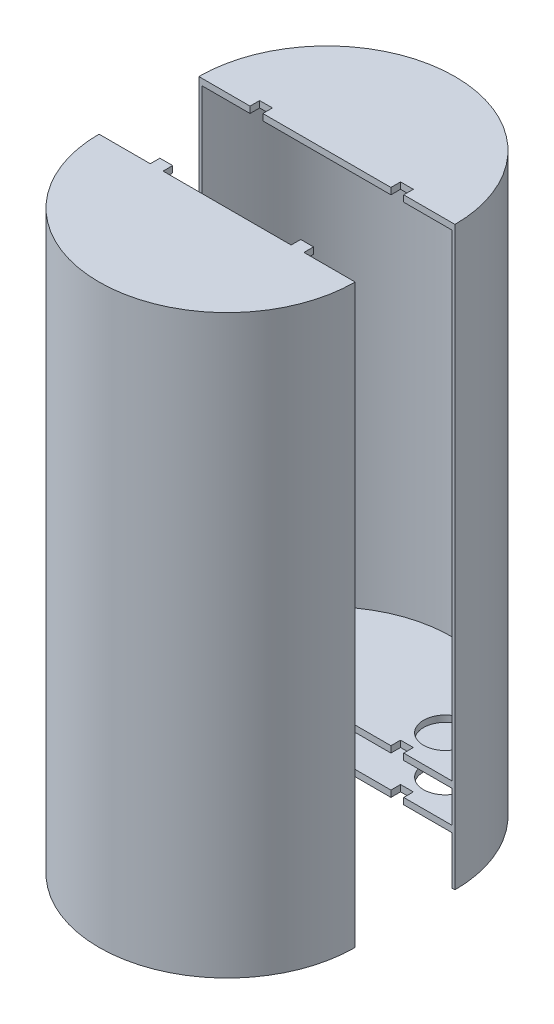
from build123d import *

# Parameters (mm, degrees)
SKETCH1_R               = 40
BOSS_EXTRUDE1_DEPTH     = 180
SKETCH3_R               = 39
CUT_EXTRUDE1_DEPTH      = 163
CUT_EXTRUDE2_START      = -15
SKETCH5_R               = 39
CUT_EXTRUDE2_DEPTH      = 15
SKETCH6_R               = 40
BOSS_EXTRUDE2_DEPTH     = 2
BOSS_EXTRUDE3_START     = -2
SKETCH7_R               = 40
BOSS_EXTRUDE3_DEPTH     = 2
SPLIT1_SURFACE_1_BACK   = 213.603
SPLIT1_SURFACE_1_DEPTH  = 427.206
SPLIT1_SURFACE_2_BACK   = 213.603
SPLIT1_SURFACE_2_DEPTH  = 427.206
BODY_MOVE_COPY1_DEPTH   = 180
BODY_MOVE_COPY1_START   = 29
BODY_MOVE_COPY1_2_DEPTH = 149
BODY_MOVE_COPY1_3_DEPTH = 15
BODY_MOVE_COPY1_START_2 = 17
BODY_MOVE_COPY1_4_DEPTH = 10
BODY_MOVE_COPY1_5_DEPTH = 180
BODY_MOVE_COPY1_START_3 = 15
BODY_MOVE_COPY1_6_DEPTH = 2
BODY_MOVE_COPY1_START_4 = 27
BODY_MOVE_COPY1_7_DEPTH = 2
BODY_MOVE_COPY1_START_5 = 178
BODY_MOVE_COPY1_8_DEPTH = 2
SKETCH9_R               = 15.2
CUT_EXTRUDE3_DEPTH      = 2
CUT_EXTRUDE4_DEPTH      = 2
SKETCH11_R              = 3.12
CUT_EXTRUDE5_DEPTH      = 172.657213337
SKETCH14_R              = 6.8
CUT_EXTRUDE6_DEPTH      = 172.657213337


# Read off the part's stored shape, not the designer's step: Body-Move/Copy1
with BuildPart() as part:
    # Sketch1 → Boss-Extrude1 (new body)
    with BuildSketch(Plane(origin=(0, 0, 0), x_dir=(1, 0, 0), z_dir=(0, 1, 0))):
        with Locations(Location((0, 0, 0), (0, 0, 90))):
            Circle(SKETCH1_R)
    extrude(amount=BOSS_EXTRUDE1_DEPTH)

    # Sketch3 → Cut-Extrude1 (cut)
    with BuildSketch(Plane(origin=(0, 180, 0), x_dir=(1, 0, 0), z_dir=(0, 1, 0))):
        with Locations(Location((0, 0, 0), (0, 0, 270))):
            Circle(SKETCH3_R)
    extrude(amount=-CUT_EXTRUDE1_DEPTH, mode=Mode.SUBTRACT)

    # Sketch5 → Cut-Extrude2 (cut)
    with BuildSketch(Plane.XZ.offset(CUT_EXTRUDE2_START)):
        with Locations(Location((0, 0, 0), (0, 0, 90))):
            Circle(SKETCH5_R)
    extrude(amount=CUT_EXTRUDE2_DEPTH, mode=Mode.SUBTRACT)

    # Sketch6 → Boss-Extrude2 (add)
    with BuildSketch(Plane(origin=(0, 27, 0), x_dir=(1, 0, 0), z_dir=(0, 1, 0))):
        with Locations(Location((0, 0, 0), (0, 0, 90))):
            Circle(SKETCH6_R)
    extrude(amount=BOSS_EXTRUDE2_DEPTH)

    # Sketch7 → Boss-Extrude3 (add)
    with BuildSketch(Plane(origin=(0, 180, 0), x_dir=(1, 0, 0), z_dir=(0, 1, 0)).offset(BOSS_EXTRUDE3_START)):
        with Locations(Location((0, 0, 0), (0, 0, 90))):
            Circle(SKETCH7_R)
    extrude(amount=BOSS_EXTRUDE3_DEPTH)


with BuildPart() as body_2:
    # Split1: the piece behind the surface
    add(part.part)
    # Split1 surface: a surface, the sketch's curves swept straight by 427.206 mm
    with BuildLine(Plane(origin=(0, 180, 0), x_dir=(1, 0, 0), z_dir=(0, 1, 0)).offset(-SPLIT1_SURFACE_1_BACK), mode=Mode.PRIVATE) as split1_surface_1_path:
        Line((-40, 0), (-24, 0))
        Line((-24, 0), (-24, 3))
        Line((-24, 3), (-20, 3))
        Line((-20, 3), (-20, 0))
        Line((-20, 0), (20, 0))
        Line((20, 0), (20, 3))
        Line((20, 3), (24, 3))
        Line((24, 3), (24, 0))
        Line((24, 0), (40, 0))
    split1_surface_1 = Shell.extrude(split1_surface_1_path.wire(), (0 * SPLIT1_SURFACE_1_DEPTH, 1 * SPLIT1_SURFACE_1_DEPTH, 0 * SPLIT1_SURFACE_1_DEPTH))
    split(bisect_by=split1_surface_1, keep=Keep.BOTTOM)

    # Body-Move/Copy1 outline → Body-Move/Copy1 (cut)
    with BuildSketch(Plane(origin=(0, 0, 0), x_dir=(1, 0, 0), z_dir=(0, 1, 0))):
        with BuildLine():
            Line((20, -28.170210697), (24, -28.170210697))
            Line((24, -28.170210697), (24, -31.170210697))
            Line((24, -31.170210697), (25.068266097, -31.170210697))
            ThreePointArc((25.068266097, -31.170210697), (36.074441395, -17.281049681), (40, 0))
            Line((40, 0), (24, 0))
            Line((24, 0), (24, 3))
            Line((24, 3), (20, 3))
            Line((20, 3), (20, 0))
            Line((20, 0), (-20, 0))
            Line((-20, 0), (-20, 3))
            Line((-20, 3), (-24, 3))
            Line((-24, 3), (-24, 0))
            Line((-24, 0), (-40, 0))
            ThreePointArc((-40, 0), (-36.074441395, -17.281049681), (-25.068266097, -31.170210697))
            Line((-25.068266097, -31.170210697), (-24, -31.170210697))
            Line((-24, -31.170210697), (-24, -28.170210697))
            Line((-24, -28.170210697), (-20, -28.170210697))
            Line((-20, -28.170210697), (-20, -31.170210697))
            Line((-20, -31.170210697), (20, -31.170210697))
            Line((20, -31.170210697), (20, -28.170210697))
        make_face()
    extrude(amount=BODY_MOVE_COPY1_DEPTH, mode=Mode.SUBTRACT)

    # Body-Move_Copy1 2 outline → Body-Move_Copy1 2 (cut)
    with BuildSketch(Plane(origin=(0, 0, 0), x_dir=(1, 0, 0), z_dir=(0, 1, 0)).offset(BODY_MOVE_COPY1_START)):
        with BuildLine():
            Line((24, -31.170210697), (24, -30.740852298))
            ThreePointArc((24, -30.740852298), (0, -39), (-24, -30.740852298))
            Line((-24, -30.740852298), (-24, -31.170210697))
            Line((-24, -31.170210697), (-25.068266097, -31.170210697))
            ThreePointArc((-25.068266097, -31.170210697), (0, -40), (25.068266097, -31.170210697))
            Line((25.068266097, -31.170210697), (24, -31.170210697))
        make_face()
    extrude(amount=BODY_MOVE_COPY1_2_DEPTH, mode=Mode.SUBTRACT)

    # Body-Move_Copy1 3 outline → Body-Move_Copy1 3 (cut)
    with BuildSketch(Plane(origin=(0, 0, 0), x_dir=(1, 0, 0), z_dir=(0, 1, 0))):
        with BuildLine():
            Line((24, -31.170210697), (24, -30.740852298))
            ThreePointArc((24, -30.740852298), (0, -39), (-24, -30.740852298))
            Line((-24, -30.740852298), (-24, -31.170210697))
            Line((-24, -31.170210697), (-25.068266097, -31.170210697))
            ThreePointArc((-25.068266097, -31.170210697), (0, -40), (25.068266097, -31.170210697))
            Line((25.068266097, -31.170210697), (24, -31.170210697))
        make_face()
    extrude(amount=BODY_MOVE_COPY1_3_DEPTH, mode=Mode.SUBTRACT)

    # Body-Move_Copy1 4 outline → Body-Move_Copy1 4 (cut)
    with BuildSketch(Plane(origin=(0, 0, 0), x_dir=(1, 0, 0), z_dir=(0, 1, 0)).offset(BODY_MOVE_COPY1_START_2)):
        with BuildLine():
            Line((24, -31.170210697), (24, -30.740852298))
            ThreePointArc((24, -30.740852298), (0, -39), (-24, -30.740852298))
            Line((-24, -30.740852298), (-24, -31.170210697))
            Line((-24, -31.170210697), (-25.068266097, -31.170210697))
            ThreePointArc((-25.068266097, -31.170210697), (0, -40), (25.068266097, -31.170210697))
            Line((25.068266097, -31.170210697), (24, -31.170210697))
        make_face()
    extrude(amount=BODY_MOVE_COPY1_4_DEPTH, mode=Mode.SUBTRACT)



with BuildPart() as part_1:
    add(part.part)

    # Split1: split by a surface, the side it looks to stays
    # Split1 surface: a surface, the sketch's curves swept straight by 427.206 mm
    with BuildLine(Plane(origin=(0, 180, 0), x_dir=(1, 0, 0), z_dir=(0, 1, 0)).offset(-SPLIT1_SURFACE_2_BACK), mode=Mode.PRIVATE) as split1_surface_2_path:
        Line((-40, 0), (-24, 0))
        Line((-24, 0), (-24, 3))
        Line((-24, 3), (-20, 3))
        Line((-20, 3), (-20, 0))
        Line((-20, 0), (20, 0))
        Line((20, 0), (20, 3))
        Line((20, 3), (24, 3))
        Line((24, 3), (24, 0))
        Line((24, 0), (40, 0))
    split1_surface_2 = Shell.extrude(split1_surface_2_path.wire(), (0 * SPLIT1_SURFACE_2_DEPTH, 1 * SPLIT1_SURFACE_2_DEPTH, 0 * SPLIT1_SURFACE_2_DEPTH))
    split(bisect_by=split1_surface_2, keep=Keep.TOP)

    # Sketch14 → Cut-Extrude6 (cut, through all)
    with BuildSketch(Plane(origin=(0, 29, 0), x_dir=(1, 0, 0), z_dir=(0, 1, 0))):
        with Locations(Location((25, 12, 0), (0, 0, 270))):
            Circle(SKETCH14_R)
    extrude(amount=-CUT_EXTRUDE6_DEPTH, mode=Mode.SUBTRACT)


with BuildPart() as body_3:
    # Body-Move_Copy1 5 outline → Body-Move_Copy1 5 (new body)
    with BuildSketch(Plane(origin=(0, 0, 0), x_dir=(1, 0, 0), z_dir=(0, 1, 0))):
        with BuildLine():
            Line((40, -31.170210697), (39, -31.170210697))
            ThreePointArc((39, -31.170210697), (0, -70.170210697), (-39, -31.170210697))
            Line((-39, -31.170210697), (-40, -31.170210697))
            ThreePointArc((-40, -31.170210697), (0, -71.170210697), (40, -31.170210697))
        make_face()
    extrude(amount=BODY_MOVE_COPY1_5_DEPTH)


with BuildPart() as body_2_1:
    add(body_2.part)

    add(body_3.part)  # Body-Move_Copy1 6 merges body 3
    # Body-Move_Copy1 6 outline → Body-Move_Copy1 6 (add)
    with BuildSketch(Plane(origin=(0, 0, 0), x_dir=(1, 0, 0), z_dir=(0, 1, 0)).offset(BODY_MOVE_COPY1_START_3)):
        with BuildLine():
            Line((39, -31.170210697), (25.068266097, -31.170210697))
            ThreePointArc((25.068266097, -31.170210697), (0, -40), (-25.068266097, -31.170210697))
            Line((-25.068266097, -31.170210697), (-39, -31.170210697))
            ThreePointArc((-39, -31.170210697), (0, -70.170210697), (39, -31.170210697))
        make_face()
    extrude(amount=BODY_MOVE_COPY1_6_DEPTH)

    # Body-Move_Copy1 7 outline → Body-Move_Copy1 7 (add)
    with BuildSketch(Plane(origin=(0, 0, 0), x_dir=(1, 0, 0), z_dir=(0, 1, 0)).offset(BODY_MOVE_COPY1_START_4)):
        with BuildLine():
            Line((39, -31.170210697), (25.068266097, -31.170210697))
            ThreePointArc((25.068266097, -31.170210697), (0, -40), (-25.068266097, -31.170210697))
            Line((-25.068266097, -31.170210697), (-39, -31.170210697))
            ThreePointArc((-39, -31.170210697), (0, -70.170210697), (39, -31.170210697))
        make_face()
    extrude(amount=BODY_MOVE_COPY1_7_DEPTH)

    # Body-Move_Copy1 8 outline → Body-Move_Copy1 8 (add)
    with BuildSketch(Plane(origin=(0, 0, 0), x_dir=(1, 0, 0), z_dir=(0, 1, 0)).offset(BODY_MOVE_COPY1_START_5)):
        with BuildLine():
            Line((39, -31.170210697), (25.068266097, -31.170210697))
            ThreePointArc((25.068266097, -31.170210697), (0, -40), (-25.068266097, -31.170210697))
            Line((-25.068266097, -31.170210697), (-39, -31.170210697))
            ThreePointArc((-39, -31.170210697), (0, -70.170210697), (39, -31.170210697))
        make_face()
    extrude(amount=BODY_MOVE_COPY1_8_DEPTH)

    # Sketch9 → Cut-Extrude3 (cut)
    with BuildSketch(Plane(origin=(0, 29, 0), x_dir=(1, 0, 0), z_dir=(0, 1, 0))):
        with Locations(Location((0, -51.170210697, 0), (0, 0, 270))):
            Circle(SKETCH9_R)
    extrude(amount=-CUT_EXTRUDE3_DEPTH, mode=Mode.SUBTRACT)

    # Sketch10 → Cut-Extrude4 (cut)
    with BuildSketch(Plane.XZ.offset(-15)):
        with BuildLine():
            Line((-10.624382335, 54.020210697), (0, 54.020210697))
            Line((0, 54.020210697), (0, 62.170210697))
            ThreePointArc((0, 62.170210697), (-6.695147497, 59.898039752), (-10.624382335, 54.020210697))
        make_face()
        with BuildLine():
            Line((0, 62.170210697), (0, 54.020210697))
            Line((0, 54.020210697), (10.624382335, 54.020210697))
            ThreePointArc((10.624382335, 54.020210697), (6.695147497, 59.898039752), (0, 62.170210697))
        make_face()
        with BuildLine():
            ThreePointArc((-10.624382335, 48.320210697), (-6.695147497, 42.442381643), (0, 40.170210697))
            Line((0, 40.170210697), (0, 48.320210697))
            Line((0, 48.320210697), (-10.624382335, 48.320210697))
        make_face()
        with BuildLine():
            Line((0, 48.320210697), (0, 40.170210697))
            ThreePointArc((0, 40.170210697), (6.695147497, 42.442381643), (10.624382335, 48.320210697))
            Line((10.624382335, 48.320210697), (0, 48.320210697))
        make_face()
    extrude(amount=-CUT_EXTRUDE4_DEPTH, mode=Mode.SUBTRACT)

    # Sketch11 → Cut-Extrude5 (cut, through all)
    with BuildSketch(Plane(origin=(0, 29, 0), x_dir=(1, 0, 0), z_dir=(0, 1, 0))):
        with Locations(Location((25, -43.170210697, 0), (0, 0, 270))):
            Circle(SKETCH11_R)
    cut_extrude5 = extrude(amount=-CUT_EXTRUDE5_DEPTH, mode=Mode.SUBTRACT)

    # Mirror1: Cut-Extrude5 across plane
    add(cut_extrude5.mirror(Plane(origin=(0, 0, 0), x_dir=(0, 0, 1), z_dir=(1, 0, 0))), mode=Mode.SUBTRACT)


solid = Compound([part_1.part, body_2_1.part])
